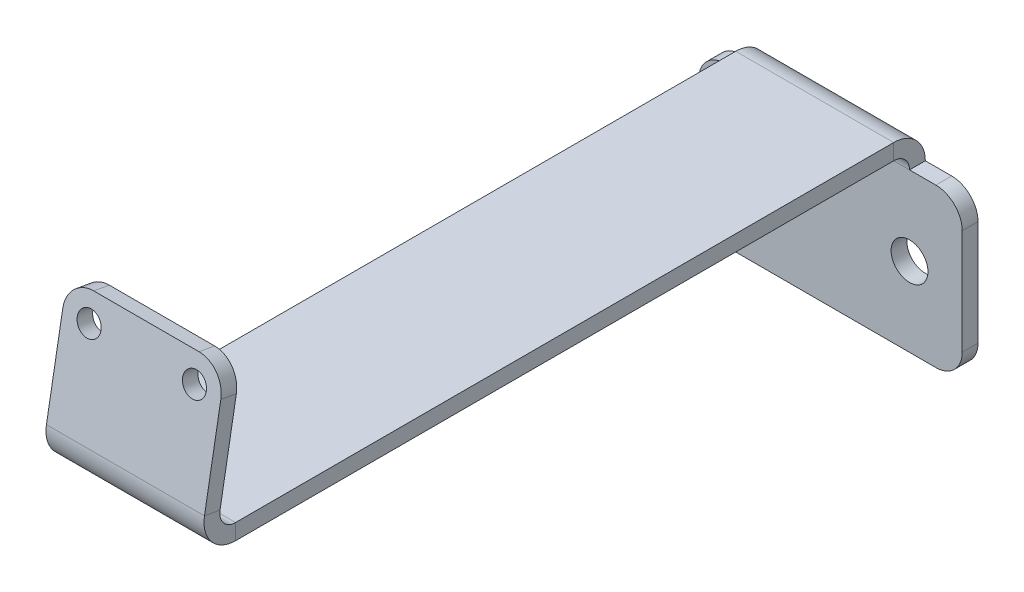
from build123d import *

# Parameters (mm, degrees)
SM_BASE_FLANGE_1_DEPTH = 3
HOLE_WIZARD_M61_D      = 7
OTHER_START            = -15
OTHER_1_DEPTH          = 30
OTHER_1_2_DEPTH        = 30
SM_EDGE_FLANGE_1_DEPTH = 30
HOLE_WIZARD_M41_D      = 4.5
HOLE_WIZARD_M41_DEPTH  = 3
FILLET_1_R             = 5
FILLET_2_R             = 5


# Read off the part's stored shape, not the designer's step: Нарисованный сгиб1
# Sheet-metal steps are written as plain solids
with BuildPart() as part:
    # Sketch 1 → Базовая кромка1 (new body)
    with BuildSketch(Plane.XY):
        Polygon((15, 30), (15, 162), (-15, 162), (-15, 30), (-25, 30), (-25, 0), (25, 0), (25, 30), align=None)
    extrude(amount=-SM_BASE_FLANGE_1_DEPTH)

    # Сверло под метчик  спиральное M61 (through all)
    with Locations(Plane.XY):
        with Locations((-15, 15), (15, 15)):
            Hole(HOLE_WIZARD_M61_D / 2)

    # Other 1 outline → Other 1 (cut)
    with BuildSketch(Plane.YZ.offset(OTHER_START)):
        with BuildLine():
            Line((162, 0), (35.196152423, 0))
            ThreePointArc((35.196152423, 0), (33, -2.196152423), (30, -3))
            Line((30, -3), (162, -3))
            Line((162, -3), (162, 0))
        make_face()
    extrude(amount=OTHER_1_DEPTH, mode=Mode.SUBTRACT)

    # Other 1 2 outline → Other 1 2 (add)
    with BuildSketch(Plane.YZ.offset(OTHER_START)):
        with BuildLine():
            Line((36, 3), (36, 127.931416529))
            Line((36, 127.931416529), (33, 127.931416529))
            Line((33, 127.931416529), (33, 3))
            ThreePointArc((33, 3), (32.121320344, 0.878679656), (30, 0))
            Line((30, 0), (35.196152423, 0))
            ThreePointArc((35.196152423, 0), (35.795554958, 1.447085729), (36, 3))
        make_face()
    extrude(amount=OTHER_1_2_DEPTH)

    # Ребро-кромка1 section (across the edge) → Ребро-кромка1 (add)
    with BuildSketch(Plane(origin=(-15, 36, 131.506677307), x_dir=(0, -0.17364817766692373, -0.9848077530122094), z_dir=(1, 0, 0))):
        with BuildLine():
            Line((-3, 3.575260778), (-3, 26.424739222))
            Line((-3, 26.424739222), (0, 26.424739222))
            Line((0, 26.424739222), (0, 3.575260778))
            ThreePointArc((0, 3.575260778), (1.071637171, 1.277127448), (3.520944533, 0.620837519))
            Line((3.520944533, 0.620837519), (4.041889066, -2.33358574))
            ThreePointArc((4.041889066, -2.33358574), (-0.856725658, -1.021005881), (-3, 3.575260778))
        make_face()
    extrude(amount=SM_EDGE_FLANGE_1_DEPTH)

    # Отверстие с зазором M41
    with Locations(Plane(origin=(0, 24.095443669, 136.652051617), x_dir=(1, 0, 0), z_dir=(0, 0.17364817766692325, 0.9848077530122094))):
        with Locations((-10, 34.041923465), (10, 34.041923465)):
            Hole(HOLE_WIZARD_M41_D / 2, depth=HOLE_WIZARD_M41_DEPTH)

    # Скругление1
    fillet_1_edges = [part.edges().sort_by_distance(p)[0] for p in [
        (-25, 0, -1.5),
        (25, 0, -1.5),
        (25, 30, -1.5),
        (-25, 30, -1.5),
    ]]
    fillet(fillet_1_edges, radius=FILLET_1_R)

    # Скругление2
    fillet_2_edges = [part.edges().sort_by_distance(p)[0] for p in [
        (-15, 62.283760324, 128.395281125),
        (15, 62.283760324, 128.395281125),
    ]]
    fillet(fillet_2_edges, radius=FILLET_2_R)


solid = part.part
